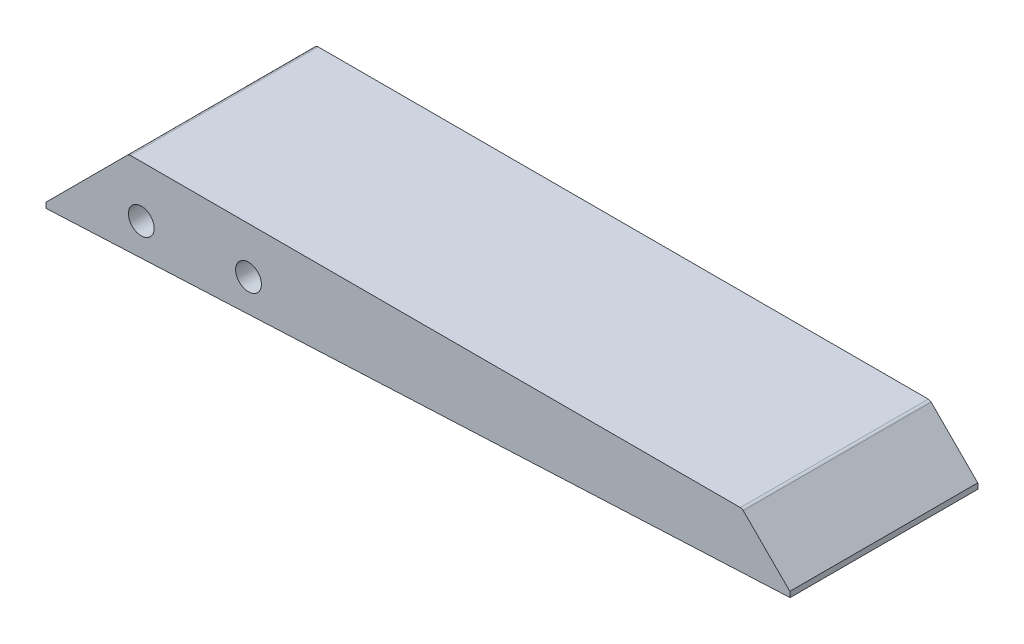
from build123d import *

# Parameters (mm, degrees)
EXTRUDE_1_DEPTH     = 35
SKETCH_2_W          = 138.720877604
SKETCH_2_H          = 35
SKETCH_2_W_2        = 135.720877604
SKETCH_2_H_2        = 32
EXTRUDE_2_DEPTH     = 1
FILLET_1_R          = 2
SKETCH_3_R          = 2.4
CUT_EXTRUDE_1_DEPTH = 6.2
CUT_EXTRUDE_START   = -6.55
SKETCH_4_R          = 2.4
CUT_EXTRUDE_2_DEPTH = 6.55
EXTRUDE_3_DEPTH     = 1


with BuildPart() as part:
    # 草图1 → 凸台-拉伸1 (new body)
    with BuildSketch(Plane.XY):
        with BuildLine():
            Line((29.763864432, 1.094424801), (168.332374142, 7.594424801))
            Line((168.332374142, 7.594424801), (159.642544089, 16.284254855))
            ThreePointArc((159.642544089, 16.284254855), (159.40357385, 16.443929664), (159.121689234, 16.5))
            Line((159.121689234, 16.5), (45.474549341, 16.5))
            ThreePointArc((45.474549341, 16.5), (45.192664725, 16.443929664), (44.953694486, 16.284254855))
            Line((44.953694486, 16.284254855), (29.763864432, 1.094424801))
        make_face()
    extrude(amount=-EXTRUDE_1_DEPTH)

    # 草图2 → 凸台-拉伸2 (add)
    with BuildSketch(Plane(origin=(0.014123223, -0.301082145, 0), x_dir=(0.9989016224758188, 0.046856681649226004, 0), z_dir=(0.046856681649226, -0.9989016224758187, 0))):
        with Locations((99.142892389, -17.5)):
            Rectangle(SKETCH_2_W, SKETCH_2_H)
        with Locations((99.142892389, -17.5)):
            Rectangle(SKETCH_2_W_2, SKETCH_2_H_2, mode=Mode.SUBTRACT)
    extrude(amount=EXTRUDE_2_DEPTH)

    # 圆角1
    fillet_1_edges = [part.edges().sort_by_distance(p)[0] for p in [
        (31.285645207, 0.665259013, -33.5),
        (166.85745005, 7.024688968, -33.5),
        (166.85745005, 7.024688968, -1.5),
        (31.285645207, 0.665259013, -1.5),
    ]]
    fillet(fillet_1_edges, radius=FILLET_1_R)

    # 草图3 → 切除-拉伸1 (cut)
    with BuildSketch(Plane.XY):
        with Locations((47.509810229, 6.932353183)):
            Circle(SKETCH_3_R)
        with Locations((67.487195651, 7.883180029)):
            Circle(SKETCH_3_R)
    extrude(amount=-CUT_EXTRUDE_1_DEPTH, mode=Mode.SUBTRACT)

    # 草图4 → 切除-拉伸2 (cut)
    with BuildSketch(Plane(origin=(0, 0, -35), x_dir=(-1, 0, 0), z_dir=(0, 0, -1)).offset(CUT_EXTRUDE_START)):
        with Locations((-47.509810229, 6.932353183)):
            Circle(SKETCH_4_R)
        with Locations((-67.487195651, 7.883180029)):
            Circle(SKETCH_4_R)
    extrude(amount=CUT_EXTRUDE_2_DEPTH, mode=Mode.SUBTRACT)

    # 草图6 → 凸台-拉伸3 (add)
    # profile 1 of 11: a face of its own
    with BuildSketch(Plane(origin=(0.014123223, -0.301082145, 0), x_dir=(0.9989016224758188, 0.046856681649226004, 0), z_dir=(0.046856681649226, -0.9989016224758187, 0))):
        Polygon((144.533247979, -18.341711689), (144.298447979, -18.200811689), (143.922747979, -18.294711689), (142.795647979, -19.468811689), (142.279047979, -19.891511689), (142.138147979, -19.891511689), (142.091147979, -19.750611689), (142.654747979, -18.247811689), (142.701647979, -17.825111689), (142.466847979, -17.496311689), (141.997247979, -17.449411689), (141.668447979, -17.731211689), (141.245747979, -18.388711689), (140.259547979, -19.374911689), (139.226347979, -20.126311689), (138.803647979, -20.314211689), (138.615747979, -20.314211689), (138.521847979, -20.220311689), (138.521847979, -19.985411689), (138.662747979, -19.609711689), (139.461147979, -18.435611689), (139.461147979, -18.106911689), (139.273247979, -17.872011689), (139.038447979, -17.778111689), (138.662747979, -17.872011689), (138.005247979, -18.623511689), (137.582547979, -19.327911689), (137.347747979, -20.126311689), (137.347747979, -20.408111689), (137.488647979, -20.783811689), (137.911347979, -21.159511689), (138.193147979, -21.253511689), (138.756647979, -21.253511689), (139.695947979, -20.877811689), (140.635247979, -20.173311689), (140.776147979, -20.220311689), (140.635247979, -20.830811689), (140.541347979, -20.924711689), (138.521847979, -21.817011689), (137.958247979, -22.192811689), (137.629547979, -22.521511689), (137.441647979, -22.850311689), (137.441647979, -23.272911689), (137.676547979, -23.648711689), (138.005247979, -23.883511689), (138.380947979, -24.024411689), (139.179347979, -24.071311689), (139.836847979, -23.883511689), (140.447347979, -23.507811689), (141.010947979, -22.850311689), (141.480647979, -21.817011689), (141.621547979, -21.300411689), (142.842547979, -20.596011689), (143.734847979, -19.844511689), (144.486347979, -18.952211689), (144.580247979, -18.764411689), align=None)
        Polygon((140.212547979, -21.957911689), (140.212547979, -22.098811689), (140.024747979, -22.474511689), (139.555047979, -22.991211689), (139.085447979, -23.226011689), (138.662747979, -23.226011689), (138.521847979, -23.085111689), (138.568847979, -22.850311689), (138.803647979, -22.568511689), (140.071647979, -21.911011689), align=None, mode=Mode.SUBTRACT)
    # profile 2 of 11: a face of its own
    with BuildSketch(Plane(origin=(0.014123223, -0.301082145, 0), x_dir=(0.9989016224758188, 0.046856681649226004, 0), z_dir=(0.046856681649226, -0.9989016224758187, 0))):
        Polygon((156.978847979, -14.866311689), (156.744047979, -14.725411689), (156.415247979, -14.725411689), (156.133447979, -14.913311689), (156.039547979, -15.148111689), (155.992547979, -16.087411689), (155.569847979, -17.167611689), (154.771547979, -18.341711689), (153.973147979, -19.046211689), (153.691347979, -18.999211689), (153.691347979, -18.341711689), (153.879147979, -17.731211689), (153.879147979, -17.308511689), (153.691347979, -17.073611689), (153.503447979, -16.979711689), (153.268647979, -16.979711689), (153.033847979, -17.073611689), (152.845947979, -17.261511689), (152.376347979, -18.106911689), (151.390047979, -19.140111689), (151.108247979, -19.327911689), (150.920447979, -19.281011689), (150.967347979, -18.905311689), (151.202247979, -18.247811689), (152.000647979, -16.791911689), (151.953647979, -16.369211689), (151.577947979, -16.134411689), (151.202247979, -16.228311689), (150.920447979, -16.510111689), (150.122047979, -17.872011689), (149.887247979, -18.623511689), (149.041847979, -19.421911689), (148.478247979, -19.844511689), (148.243447979, -19.938511689), (147.961647979, -19.938511689), (147.726847979, -19.797611689), (147.351147979, -19.421911689), (147.351147979, -19.281011689), (149.182747979, -17.543311689), (149.276647979, -17.355411689), (149.276647979, -17.120611689), (149.041847979, -16.838811689), (148.666147979, -16.791911689), (148.337347979, -16.932811689), (146.646647979, -18.482611689), (146.505747979, -18.482611689), (145.660447979, -17.543311689), (145.190747979, -17.496311689), (145.002947979, -17.590311689), (144.815047979, -17.825111689), (144.815047979, -18.106911689), (145.754347979, -19.281011689), (145.754347979, -19.374911689), (144.110647979, -21.206511689), (143.922747979, -21.582211689), (143.969747979, -21.864011689), (144.251547979, -22.098811689), (144.580247979, -22.098811689), (144.815047979, -22.004911689), (146.458847979, -20.220311689), (146.599747979, -20.220311689), (147.069347979, -20.642911689), (147.492047979, -20.877811689), (148.290447979, -20.924711689), (149.088847979, -20.549011689), (149.746347979, -19.938511689), (149.887247979, -19.938511689), (150.169047979, -20.267211689), (150.403847979, -20.408111689), (150.920447979, -20.455111689), (151.249147979, -20.361111689), (151.812747979, -20.032411689), (152.517247979, -19.374911689), (152.658147979, -19.421911689), (152.752047979, -19.656711689), (153.033847979, -19.938511689), (153.456547979, -20.126311689), (154.067047979, -20.079411689), (154.536647979, -19.891511689), (155.288147979, -19.327911689), (155.757747979, -18.858311689), (156.274347979, -18.153811689), (156.744047979, -17.308511689), (157.119747979, -16.040411689), (157.119747979, -15.195111689), align=None)
    # profile 3 of 11: a face of its own
    with BuildSketch(Plane(origin=(0.014123223, -0.301082145, 0), x_dir=(0.9989016224758188, 0.046856681649226004, 0), z_dir=(0.046856681649226, -0.9989016224758187, 0))):
        Polygon((103.178, -10.815686264), (102.5205, -10.486886264), (101.7221, -10.252086264), (100.2192, -10.252086264), (99.5148, -10.533886264), (99.0921, -10.862586264), (97.4014, -11.614086264), (95.8985, -12.130686264), (94.8653, -12.271586264), (94.6305, -12.459386264), (94.5365, -12.647286264), (94.5835, -12.929086264), (95.0531, -13.398686264), (95.4289, -13.586586264), (96.0864, -13.774386264), (97.6362, -13.774386264), (97.824, -14.103186264), (97.871, -14.995486264), (97.7771, -15.324186264), (96.556, -15.793886264), (95.8046, -16.263486264), (94.9592, -15.981686264), (94.4896, -15.981686264), (94.1608, -16.122586264), (94.0199, -16.263486264), (93.926, -16.545286264), (94.2078, -17.484586264), (94.2548, -18.893486264), (94.3956, -19.738886264), (94.6305, -20.396386264), (94.9123, -20.865986264), (95.4758, -21.429586264), (95.9924, -21.664386264), (96.603, -21.711386264), (97.3544, -21.476586264), (97.5423, -21.476586264), (97.5892, -21.664386264), (97.4483, -22.321886264), (97.2605, -22.791586264), (96.7908, -23.355086264), (95.1471, -23.824786264), (93.6442, -24.106586264), (92.7519, -24.153486264), (92.4701, -24.294386264), (92.1883, -24.623186264), (92.0944, -25.092786264), (92.3292, -25.656386264), (92.7519, -26.079086264), (93.4094, -26.454786264), (93.973, -26.642586264), (95.5228, -26.642586264), (96.4621, -26.407786264), (100.5949, -24.904986264), (102.9431, -24.200486264), (103.3658, -24.247486264), (103.9764, -25.280686264), (104.446, -25.703386264), (104.9156, -25.938186264), (105.3853, -26.032086264), (105.9019, -25.985086264), (106.4185, -25.750286264), (106.7942, -25.374586264), (107.029, -24.764086264), (107.029, -24.200486264), (106.8881, -23.683886264), (106.5594, -23.120286264), (105.8549, -22.368886264), (104.9156, -21.711386264), (103.8824, -21.241686264), (103.178, -21.053886264), (102.6144, -21.100886264), (102.4265, -21.194786264), (102.2387, -21.476586264), (102.3326, -21.852286264), (102.6144, -22.180986264), (102.5205, -22.368886264), (101.2524, -22.556686264), (100.2662, -22.791586264), (99.9374, -22.744586264), (99.9374, -22.603686264), (100.2662, -21.946186264), (100.5949, -20.772086264), (100.7358, -20.678186264), (101.5342, -20.490286264), (102.8492, -20.349386264), (103.5067, -20.114586264), (103.8355, -19.785886264), (103.9764, -19.457086264), (104.5399, -18.658686264), (105.3383, -17.014986264), (105.3383, -16.357486264), (105.2444, -16.075686264), (105.0096, -15.699986264), (104.1642, -14.995486264), (103.6006, -14.713686264), (102.5674, -14.431886264), (101.5812, -14.431886264), (101.2524, -14.525886264), (100.8298, -14.478886264), (100.7828, -13.962286264), (100.6889, -13.774386264), (100.6889, -13.633486264), (100.7828, -13.539586264), (103.2249, -12.929086264), (103.7885, -12.459386264), (103.9294, -12.130686264), (103.8824, -11.614086264), (103.7415, -11.332286264), align=None)
        Polygon((97.7301, -17.296686264), (97.7301, -19.316186264), (97.4014, -19.550986264), (96.8848, -19.597986264), (96.6969, -19.457086264), (96.556, -19.034386264), (96.509, -17.907286264), (96.6499, -17.766386264), (97.5892, -17.296686264), align=None, mode=Mode.SUBTRACT)
        Polygon((101.816, -16.357486264), (102.0508, -16.545286264), (102.0978, -16.686186264), (102.0508, -17.061886264), (101.863, -17.578486264), (101.3933, -18.376886264), (101.0646, -18.611786264), (100.7828, -18.658686264), (100.7358, -18.189086264), (100.8298, -16.592286264), (100.9237, -16.498386264), (101.2524, -16.404386264), align=None, mode=Mode.SUBTRACT)
    # profile 4 of 11: a face of its own
    with BuildSketch(Plane(origin=(0.014123223, -0.301082145, 0), x_dir=(0.9989016224758188, 0.046856681649226004, 0), z_dir=(0.046856681649226, -0.9989016224758187, 0))):
        Polygon((128.0221, -9.970286264), (127.5524, -9.923386264), (126.9419, -10.299086264), (124.7815, -12.459386264), (124.6406, -12.459386264), (123.2787, -10.862586264), (122.9969, -10.721786264), (122.7151, -10.721786264), (122.3394, -10.956586264), (122.2455, -11.332286264), (122.3864, -11.660986264), (123.7483, -13.398686264), (123.7483, -13.539586264), (122.1515, -15.418186264), (121.541, -16.310486264), (121.3062, -16.780086264), (121.3062, -17.155886264), (121.4471, -17.390686264), (121.7289, -17.531586264), (122.0106, -17.531586264), (122.2455, -17.437586264), (122.4803, -17.202786264), (123.1378, -16.216586264), (124.5937, -14.478886264), (124.7346, -14.478886264), (125.439, -15.089386264), (125.9556, -15.418186264), (126.4253, -15.465086264), (126.754, -15.277286264), (126.848, -15.089386264), (126.801, -14.713686264), (125.5799, -13.539586264), (125.5799, -13.445686264), (128.069, -10.862586264), (128.2569, -10.533886264), (128.2569, -10.299086264), align=None)
    # profile 5 of 11: a face of its own
    with BuildSketch(Plane(origin=(0.014123223, -0.301082145, 0), x_dir=(0.9989016224758188, 0.046856681649226004, 0), z_dir=(0.046856681649226, -0.9989016224758187, 0))):
        Polygon((132.2489, -9.547586264), (131.8262, -9.406686264), (131.4505, -9.406686264), (130.9339, -9.547586264), (130.4642, -9.829386264), (130.3233, -9.829386264), (130.2764, -9.406686264), (129.9476, -9.077986264), (129.5719, -9.077986264), (129.384, -9.171886264), (129.1962, -9.406686264), (128.2099, -12.177586264), (127.3646, -15.277286264), (126.848, -18.001186264), (126.848, -18.611786264), (127.0828, -18.940486264), (127.5055, -19.034386264), (127.7403, -18.940486264), (127.9751, -18.658686264), (128.2099, -17.108886264), (128.7735, -14.760686264), (129.6189, -14.713686264), (130.5112, -14.244086264), (130.8869, -13.962286264), (131.6853, -13.163886264), (132.3898, -12.130686264), (132.7185, -11.285286264), (132.8124, -10.533886264), (132.6246, -9.923386264), align=None)
        Polygon((131.5444, -10.439986264), (131.6383, -10.674786264), (131.5914, -11.003486264), (131.4505, -11.426186264), (130.9808, -12.224586264), (130.0885, -13.210886264), (129.6658, -13.539586264), (129.1962, -13.727486264), (129.1492, -13.492586264), (129.431, -12.741186264), (130.0415, -11.660986264), (130.8399, -10.768686264), (131.3565, -10.439986264), align=None, mode=Mode.SUBTRACT)
    # profile 6 of 11: a face of its own
    with BuildSketch(Plane(origin=(0.014123223, -0.301082145, 0), x_dir=(0.9989016224758188, 0.046856681649226004, 0), z_dir=(0.046856681649226, -0.9989016224758187, 0))):
        Polygon((46.3512, -7.669086264), (46.2103, -8.044786264), (46.2103, -8.326586264), (46.4921, -8.890086264), (47.0556, -9.453686264), (48.6524, -10.674786264), (48.5115, -11.238386264), (47.8071, -12.741186264), (47.8071, -13.022986264), (47.9949, -13.210886264), (48.4176, -13.210886264), (49.3569, -12.553386264), (50.3431, -12.036786264), (50.8128, -11.895886264), (51.3764, -11.895886264), (51.9399, -11.754986264), (52.5974, -11.379186264), (52.9262, -11.050486264), (53.161, -10.674786264), (53.3019, -10.017286264), (53.161, -9.453686264), (52.9731, -9.124986264), (52.4565, -8.561386264), (52.0808, -8.279586264), (50.9537, -7.669086264), (49.8735, -7.293386264), (48.6524, -7.058486264), (47.1965, -7.105486264), (46.7269, -7.293386264), align=None)
    # profile 7 of 11: a face of its own
    with BuildSketch(Plane(origin=(0.014123223, -0.301082145, 0), x_dir=(0.9989016224758188, 0.046856681649226004, 0), z_dir=(0.046856681649226, -0.9989016224758187, 0))):
        Polygon((154.2281, -7.434186264), (154.0403, -7.199386264), (153.6646, -7.199386264), (152.0678, -8.279586264), (151.5042, -8.514386264), (151.1755, -8.561386264), (151.0815, -8.467486264), (151.0815, -8.326586264), (151.5042, -7.011586264), (151.4573, -6.494986264), (151.2224, -6.213186264), (150.9876, -6.119286264), (150.518, -6.166186264), (150.0014, -6.447986264), (149.2969, -7.058486264), (149.156, -7.011586264), (149.109, -6.635886264), (148.9212, -6.447986264), (148.4515, -6.400986264), (148.2167, -6.541886264), (148.0289, -6.823686264), (147.5123, -8.044786264), (146.7139, -8.890086264), (145.9624, -9.547586264), (145.8685, -9.547586264), (145.8215, -9.312786264), (146.573, -7.387286264), (146.573, -7.152486264), (146.3851, -6.870686264), (146.1973, -6.776686264), (145.9155, -6.776686264), (145.7276, -6.870686264), (145.4928, -7.152486264), (144.7883, -8.749186264), (144.6005, -9.500686264), (144.6005, -10.205086264), (144.9292, -10.674786264), (145.258, -10.815686264), (145.5398, -10.815686264), (146.0564, -10.627786264), (147.0896, -9.782486264), (147.2305, -9.782486264), (147.3244, -9.970286264), (147.5123, -10.111186264), (147.9819, -10.111186264), (148.3576, -9.782486264), (148.7333, -9.218886264), (149.8135, -7.950886264), (149.9544, -7.997786264), (149.9074, -8.796186264), (150.0014, -9.077986264), (150.2362, -9.359786264), (150.7998, -9.594586264), (151.6451, -9.500686264), (152.6314, -9.077986264), (153.5237, -8.514386264), (153.9464, -8.138686264), (154.2281, -7.762986264), align=None)
    # profile 8 of 11: a face of its own
    with BuildSketch(Plane(origin=(0.014123223, -0.301082145, 0), x_dir=(0.9989016224758188, 0.046856681649226004, 0), z_dir=(0.046856681649226, -0.9989016224758187, 0))):
        Polygon((132.8594, -12.882086264), (133.0003, -13.210886264), (133.2351, -13.445686264), (133.5639, -13.586586264), (133.8926, -13.586586264), (134.644, -13.210886264), (135.5364, -12.318486264), (135.6303, -12.318486264), (135.7712, -12.506386264), (136.006, -12.647286264), (136.5226, -12.647286264), (136.7574, -12.553386264), (137.0862, -12.318486264), (137.9315, -11.426186264), (138.0255, -11.426186264), (138.1664, -11.707986264), (138.4012, -11.895886264), (139.0117, -11.942786264), (139.6223, -11.567086264), (140.0449, -11.144386264), (140.7964, -10.205086264), (141.3599, -9.359786264), (142.0174, -9.688486264), (143.0976, -9.829386264), (143.1915, -10.017286264), (142.7689, -10.392986264), (142.0174, -10.674786264), (141.7356, -10.674786264), (141.4069, -10.392986264), (141.1721, -10.392986264), (140.9842, -10.486886264), (140.7964, -10.674786264), (140.7024, -10.909586264), (140.7024, -11.144386264), (140.7964, -11.332286264), (140.9842, -11.520086264), (141.5478, -11.707986264), (142.2992, -11.660986264), (143.1915, -11.332286264), (143.7081, -11.003486264), (144.1778, -10.533886264), (144.4126, -10.064186264), (144.4126, -9.735486264), (144.2248, -9.312786264), (143.943, -9.077986264), (143.2855, -8.843186264), (142.534, -8.749186264), (142.4871, -8.467486264), (143.0506, -7.950886264), (143.1915, -7.997786264), (143.2385, -8.232586264), (143.4264, -8.373486264), (143.849, -8.326586264), (144.1308, -8.091786264), (144.4126, -7.669086264), (144.4596, -7.293386264), (144.3656, -7.058486264), (144.2248, -6.917586264), (143.896, -6.776686264), (143.4264, -6.776686264), (142.8158, -6.964586264), (142.1583, -7.340286264), (141.4069, -8.091786264), (140.8903, -8.467486264), (139.2465, -10.533886264), (139.1056, -10.486886264), (139.1056, -10.345986264), (139.4344, -9.218886264), (139.4344, -8.702286264), (139.1526, -8.420486264), (138.683, -8.467486264), (138.4481, -8.702286264), (138.0724, -9.594586264), (137.7437, -10.111186264), (136.8044, -11.238386264), (136.6635, -11.191386264), (136.6635, -11.050486264), (137.0392, -10.064186264), (137.274, -9.641586264), (137.321, -9.124986264), (137.0862, -8.843186264), (136.9453, -8.796186264), (136.5226, -8.890086264), (136.1469, -9.406686264), (135.7712, -10.158186264), (135.5364, -10.862586264), (135.0198, -11.473186264), (134.1274, -12.365486264), (134.0335, -12.365486264), (133.9865, -12.083686264), (134.0805, -11.520086264), (134.4092, -10.299086264), (135.4424, -7.809986264), (136.006, -6.025286264), (136.006, -5.696586264), (135.7712, -5.367786264), (135.2076, -5.367786264), (134.9258, -5.649586264), (134.5031, -6.400986264), (134.1274, -7.246386264), (133.4699, -9.124986264), (133.0473, -10.721786264), (132.8594, -11.754986264), align=None)
    # profile 9 of 11: a face of its own
    with BuildSketch(Plane(origin=(0.014123223, -0.301082145, 0), x_dir=(0.9989016224758188, 0.046856681649226004, 0), z_dir=(0.046856681649226, -0.9989016224758187, 0))):
        Polygon((146.9956, -4.898186264), (146.573, -4.898186264), (146.1033, -5.320886264), (145.8215, -5.931386264), (145.8685, -6.260086264), (146.0564, -6.494986264), (146.4321, -6.588886264), (146.7608, -6.447986264), (147.1365, -5.931386264), (147.3244, -5.367786264), (147.2305, -5.085986264), align=None)
    # profile 10 of 11: a face of its own
    with BuildSketch(Plane(origin=(0.014123223, -0.301082145, 0), x_dir=(0.9989016224758188, 0.046856681649226004, 0), z_dir=(0.046856681649226, -0.9989016224758187, 0))):
        Polygon((83.1712, -24.294386264), (82.9833, -24.012586264), (82.7955, -23.918686264), (82.4198, -23.918686264), (76.0796, -25.186786264), (73.6844, -25.562486264), (71.1483, -25.844186264), (69.6455, -25.938186264), (67.1094, -25.938186264), (65.1839, -25.797286264), (64.7142, -25.703386264), (64.7612, -25.562486264), (65.2778, -25.562486264), (66.264, -25.186786264), (67.2033, -24.341386264), (67.579, -23.824786264), (68.0956, -22.791586264), (68.3774, -22.040086264), (68.7062, -20.772086264), (68.941, -19.316186264), (69.1758, -19.316186264), (70.209, -19.738886264), (71.7119, -20.490286264), (74.5767, -22.134086264), (75.9856, -22.603686264), (76.9719, -22.603686264), (77.6764, -22.321886264), (78.099, -21.946186264), (78.3808, -21.382586264), (78.3808, -20.772086264), (78.2869, -20.443386264), (77.8173, -19.738886264), (77.3476, -19.316186264), (75.9856, -18.517786264), (74.3419, -17.907286264), (72.6512, -17.484586264), (70.5848, -17.155886264), (69.1289, -17.061886264), (68.894, -16.967986264), (68.941, -16.827086264), (70.8196, -16.122586264), (72.1815, -15.418186264), (73.3556, -14.619786264), (74.201, -13.774386264), (74.4828, -13.257786264), (74.5298, -12.506386264), (74.248, -11.895886264), (73.6844, -11.379186264), (73.2148, -11.144386264), (72.5573, -10.956586264), (71.524, -10.956586264), (70.6787, -11.238386264), (70.3969, -11.614086264), (70.4908, -11.942786264), (70.6787, -12.130686264), (70.6787, -12.365486264), (70.5378, -12.647286264), (69.5985, -13.821386264), (69.0349, -14.384986264), (68.0956, -15.136386264), (67.9078, -15.042486264), (67.579, -14.525886264), (66.6398, -13.633486264), (66.0762, -13.257786264), (65.1369, -12.835086264), (65.1369, -12.741186264), (66.5928, -11.379186264), (67.2503, -10.580886264), (67.4381, -10.158186264), (67.4381, -9.641586264), (67.1564, -9.124986264), (67.2033, -8.984086264), (70.5848, -7.762986264), (71.1483, -7.481186264), (71.571, -7.058486264), (71.7589, -6.729786264), (71.7589, -5.837486264), (71.524, -5.414786264), (70.9135, -4.898186264), (70.256, -4.616386264), (69.7864, -4.522486264), (68.894, -4.522486264), (68.1896, -4.663386264), (67.3912, -4.945086264), (62.7417, -7.152486264), (60.2526, -8.185686264), (57.9983, -8.890086264), (56.8712, -9.077986264), (56.3076, -9.077986264), (56.0258, -9.218886264), (55.8849, -9.453686264), (55.9789, -9.829386264), (56.4485, -10.205086264), (56.9181, -10.439986264), (57.8105, -10.674786264), (58.7498, -10.768686264), (59.9239, -10.721786264), (61.1919, -10.533886264), (61.8494, -10.345986264), (62.0373, -10.345986264), (62.0842, -10.533886264), (61.2858, -11.520086264), (60.0648, -12.741186264), (59.1255, -13.539586264), (57.9983, -14.384986264), (56.8712, -15.089386264), (56.0258, -15.512086264), (55.5092, -15.652986264), (55.3214, -15.793886264), (55.2274, -16.075686264), (55.4153, -16.310486264), (55.744, -16.451386264), (56.3546, -16.498386264), (57.9514, -16.263486264), (58.8437, -16.028686264), (59.8299, -15.652986264), (60.0648, -15.699986264), (59.9708, -15.981686264), (59.6421, -16.357486264), (58.1392, -17.672486264), (56.4485, -18.846586264), (55.838, -19.175286264), (55.3214, -19.316186264), (55.0865, -19.644986264), (55.1805, -19.926786264), (55.6501, -20.255486264), (56.1667, -20.396386264), (57.106, -20.396386264), (57.5756, -20.302486264), (58.5149, -19.973686264), (59.3603, -19.550986264), (60.5344, -18.752586264), (61.6146, -17.813386264), (61.7555, -17.813386264), (61.8494, -17.907286264), (61.8964, -18.142086264), (61.4267, -18.846586264), (60.6283, -19.691886264), (58.7967, -21.194786264), (57.7165, -21.899186264), (56.2606, -22.650686264), (55.3214, -23.026386264), (54.476, -23.261186264), (54.2881, -23.495986264), (54.3351, -23.683886264), (54.6639, -23.918686264), (55.1805, -24.012586264), (56.4015, -23.918686264), (58.2331, -23.542986264), (60.7223, -22.650686264), (61.098, -23.402086264), (62.0842, -24.482286264), (62.9765, -25.092786264), (63.5871, -25.374586264), (64.0098, -25.468486264), (64.0098, -25.656386264), (54.2881, -24.294386264), (51.4703, -24.059586264), (51.4233, -23.918686264), (51.893, -23.589986264), (52.4565, -22.932486264), (52.6444, -22.509786264), (52.6914, -21.993186264), (52.4565, -21.335686264), (51.3294, -19.879786264), (51.2355, -19.550986264), (51.2355, -19.081386264), (51.3294, -18.752586264), (51.7051, -18.095086264), (53.208, -16.451386264), (53.3958, -16.028686264), (53.3958, -15.699986264), (53.3019, -15.371186264), (53.114, -15.089386264), (52.6914, -14.713686264), (52.2217, -14.478886264), (51.4703, -14.290986264), (50.531, -14.290986264), (49.8265, -14.478886264), (49.4978, -14.666786264), (49.0281, -15.183386264), (46.9617, -16.075686264), (45.4119, -16.592286264), (44.1439, -16.827086264), (43.8151, -17.108886264), (43.6742, -17.390686264), (43.6742, -17.860286264), (43.7681, -18.048186264), (44.1439, -18.423886264), (44.6135, -18.658686264), (45.271, -18.846586264), (46.3981, -18.846586264), (46.9148, -18.752586264), (48.7464, -18.142086264), (48.7933, -18.329986264), (48.5115, -19.175286264), (48.5115, -19.738886264), (48.7464, -20.349386264), (49.4508, -21.288686264), (49.5917, -21.664386264), (49.4508, -22.180986264), (49.0751, -22.603686264), (48.6055, -22.932486264), (47.3844, -23.449086264), (42.0305, -24.341386264), (39.2126, -25.092786264), (38.743, -25.327586264), (38.4142, -25.656386264), (38.2733, -26.032086264), (38.2733, -26.313886264), (38.4612, -26.783486264), (38.743, -27.112286264), (39.2596, -27.487986264), (40.1989, -27.816786264), (41.0442, -27.863686264), (42.1244, -27.581886264), (44.4726, -26.454786264), (46.2103, -25.985086264), (48.1828, -25.750286264), (50.2962, -25.750286264), (52.0808, -25.891186264), (54.5699, -26.266886264), (57.1999, -26.830486264), (64.4794, -28.709086264), (67.5321, -29.366586264), (70.209, -29.742286264), (72.6981, -29.789186264), (74.201, -29.601386264), (75.1873, -29.366586264), (77.0189, -28.709086264), (78.193, -28.145486264), (80.1655, -26.971386264), (81.5744, -25.985086264), (82.3728, -25.327586264), (83.0303, -24.670086264), (83.1712, -24.435286264), align=None)
        Polygon((64.5733, -19.316186264), (64.6203, -19.691886264), (64.4324, -20.959986264), (64.1037, -22.040086264), (63.8219, -22.556686264), (63.3992, -22.885486264), (62.7417, -22.932486264), (62.0373, -22.697586264), (61.5206, -22.415886264), (61.5206, -22.227986264), (62.0373, -21.946186264), (62.8826, -21.335686264), (63.681, -20.584286264), (64.1037, -20.067586264), (64.4324, -19.363186264), align=None, mode=Mode.SUBTRACT)
        Polygon((61.1449, -15.183386264), (62.366, -14.572786264), (62.9296, -14.197086264), (63.1174, -14.197086264), (63.5401, -14.666786264), (64.0098, -15.465086264), (64.2915, -16.216586264), (64.3855, -16.827086264), (64.1976, -16.920986264), (62.366, -17.155886264), (62.319, -16.967986264), (62.5069, -16.592286264), (62.5069, -16.216586264), (62.413, -15.981686264), (62.0373, -15.605986264), (61.8024, -15.465086264), (61.1919, -15.324186264), align=None, mode=Mode.SUBTRACT)
    # profile 11 of 11: a face of its own
    with BuildSketch(Plane(origin=(0.014123223, -0.301082145, 0), x_dir=(0.9989016224758188, 0.046856681649226004, 0), z_dir=(0.046856681649226, -0.9989016224758187, 0))):
        Polygon((123.2787, -26.032086264), (123.0908, -25.186786264), (122.856, -24.576186264), (122.4803, -23.824786264), (121.6349, -22.462786264), (119.6624, -19.879786264), (118.6292, -18.705686264), (118.0187, -18.235986264), (117.549, -18.282986264), (117.3612, -18.517786264), (117.3612, -18.846586264), (117.9248, -20.396386264), (118.2535, -21.664386264), (118.4414, -22.791586264), (118.4414, -24.106586264), (118.3005, -24.576186264), (118.0656, -24.857986264), (117.7369, -24.998886264), (116.8446, -24.998886264), (115.9053, -24.810986264), (114.919, -24.482286264), (114.1206, -24.106586264), (113.3692, -23.636886264), (112.7117, -23.120286264), (111.7255, -22.087086264), (111.068, -21.100886264), (110.3635, -19.504086264), (109.8939, -17.719386264), (109.706, -16.028686264), (109.753, -14.056186264), (110.0348, -12.083686264), (110.2226, -11.332286264), (110.7392, -9.923386264), (111.6315, -8.185686264), (111.6315, -7.199386264), (111.2089, -6.400986264), (110.4105, -5.602586264), (109.2364, -4.804186264), (108.6728, -4.522486264), (107.7335, -4.193686264), (107.2169, -4.099786264), (105.8549, -4.099786264), (104.399, -4.287586264), (102.4265, -4.663386264), (97.4953, -5.931386264), (95.4289, -6.635886264), (93.879, -7.340286264), (93.2215, -7.762986264), (92.8458, -8.138686264), (92.611, -8.514386264), (92.5171, -8.514386264), (92.1414, -8.185686264), (91.249, -7.809986264), (90.5915, -7.809986264), (90.2158, -7.950886264), (89.8871, -8.232586264), (89.7462, -8.467486264), (89.6523, -8.890086264), (89.6523, -9.312786264), (89.8401, -10.486886264), (89.8401, -13.398686264), (89.7462, -14.760686264), (89.3705, -17.437586264), (88.8069, -19.832786264), (87.8676, -22.556686264), (87.0692, -24.106586264), (86.8814, -24.294386264), (86.6935, -24.200486264), (86.5996, -23.449086264), (86.3178, -23.167286264), (85.989, -23.214286264), (85.5194, -23.777786264), (85.2376, -24.388386264), (85.0028, -25.186786264), (84.9089, -25.844186264), (84.9089, -26.642586264), (85.1437, -27.394086264), (85.7073, -27.957586264), (86.083, -28.098486264), (86.7874, -28.098486264), (87.351, -27.910686264), (88.2433, -27.347086264), (89.1356, -26.501686264), (89.981, -25.421586264), (90.9203, -23.871786264), (91.6248, -22.321886264), (92.3292, -20.349386264), (93.1746, -16.733186264), (93.4094, -15.042486264), (93.5503, -13.257786264), (93.5503, -11.050486264), (93.3624, -9.970286264), (93.4564, -9.782486264), (94.7714, -9.782486264), (100.5949, -7.856886264), (103.5537, -7.105486264), (105.4792, -6.776686264), (106.3246, -6.823686264), (106.5594, -7.058486264), (106.6533, -7.293386264), (106.6533, -8.279586264), (106.2306, -11.520086264), (106.0898, -14.478886264), (106.1837, -17.061886264), (106.5124, -19.128386264), (106.9351, -20.537286264), (107.6865, -22.274986264), (108.6728, -23.871786264), (109.753, -25.186786264), (111.3967, -26.642586264), (112.4299, -27.347086264), (113.8858, -28.145486264), (115.1539, -28.662086264), (116.7976, -29.131786264), (117.8778, -29.319586264), (119.0049, -29.413486264), (119.8033, -29.413486264), (120.9305, -29.272586264), (121.8228, -28.990886264), (122.4803, -28.568186264), (122.856, -28.145486264), (123.1848, -27.440986264), (123.2787, -26.924386264), align=None)
    extrude(amount=EXTRUDE_3_DEPTH)


solid = part.part
